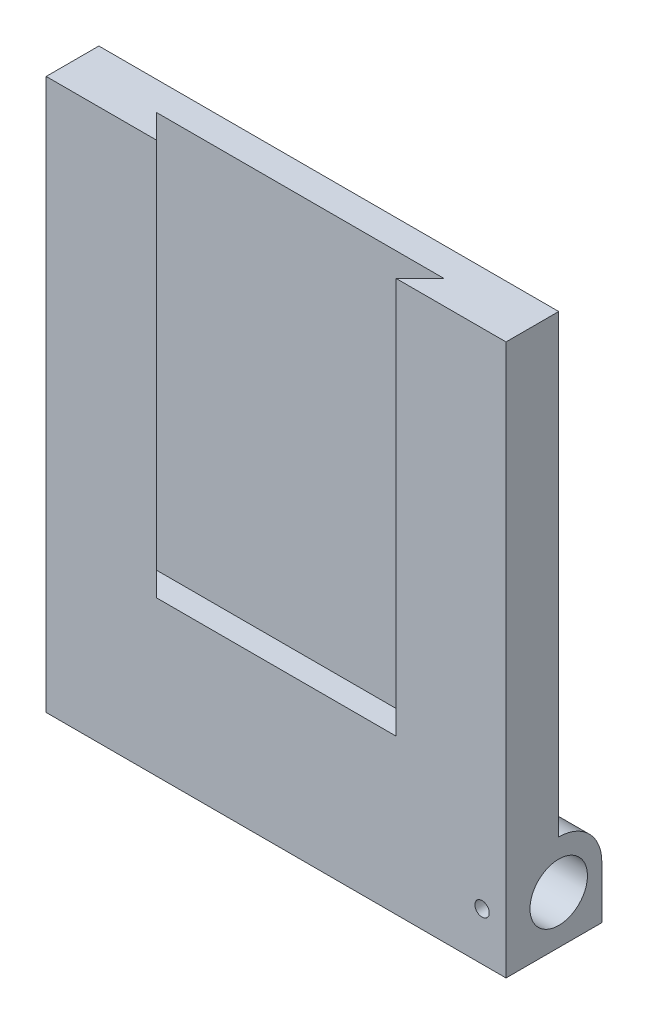
from build123d import *

# Parameters (mm, degrees)
BOSS_EXTRUDE1_DEPTH = 10
BOSS_EXTRUDE3_DEPTH = 10
CUT_EXTRUDE1_DEPTH  = 20
CUT_EXTRUDE2_DEPTH  = 20
SKETCH5_R           = 6
CUT_EXTRUDE3_DEPTH  = 18
SKETCH11_W          = 96
SKETCH11_H          = 11
BOSS_EXTRUDE2_DEPTH = 95
CUT_EXTRUDE10_DEPTH = 20
CUT_EXTRUDE11_DEPTH = 82.75
FILLET3_R           = 9
SKETCH18_R          = 1.5
CUT_EXTRUDE12_DEPTH = 10


with BuildPart() as part:
    # Sketch2 → Boss-Extrude1 (new body)
    with BuildSketch(Plane(origin=(0, 0, 0), x_dir=(1, 0, 0), z_dir=(0, 1, 0))):
        Polygon((-48, 0), (48, 0), (48, 20), (10, 20), (10, 11), (-10, 11), (-10, 20), (-48, 20), align=None)
    extrude(amount=BOSS_EXTRUDE1_DEPTH)

    # Sketch16 → Boss-Extrude3 (add)
    with BuildSketch(Plane.XZ):
        Polygon((-48, 0), (48, 0), (48, -20), (10, -20), (10, -10), (-10, -10), (-10, -20), (-48, -20), align=None)
    extrude(amount=BOSS_EXTRUDE3_DEPTH)

    # Sketch3 → Cut-Extrude1 (cut)
    with BuildSketch(Plane(origin=(-10, 0, 0), x_dir=(0, 0, -1), z_dir=(1, 0, 0))):
        Polygon((16.773502692, 0), (13.886751346, 5), (8.113248654, 5), (5.226497308, 0), (8.113248654, -5), (13.886751346, -5), align=None)
    extrude(amount=-CUT_EXTRUDE1_DEPTH, mode=Mode.SUBTRACT)

    # Sketch4 → Cut-Extrude2 (cut)
    with BuildSketch(Plane.ZY.offset(-10)):
        Polygon((-16.773502692, 0), (-13.886751346, -5), (-12, -5), (-12, -10), (-10, -10), (-10, -5), (-8.113248654, -5), (-5.226497308, 0), (-8.113248654, 5), (-13.886751346, 5), align=None)
    extrude(amount=-CUT_EXTRUDE2_DEPTH, mode=Mode.SUBTRACT)

    # Sketch5 → Cut-Extrude3 (cut)
    with BuildSketch(Plane.ZY.offset(-30)):
        with Locations((-11, 0)):
            Circle(SKETCH5_R)
    extrude(amount=-CUT_EXTRUDE3_DEPTH, mode=Mode.SUBTRACT)

    # Sketch11 → Boss-Extrude2 (add)
    with BuildSketch(Plane(origin=(0, 10, 0), x_dir=(1, 0, 0), z_dir=(0, 1, 0))):
        with Locations((0, 5.5)):
            Rectangle(SKETCH11_W, SKETCH11_H)
    extrude(amount=BOSS_EXTRUDE2_DEPTH)

    # Sketch14 → Cut-Extrude10 (cut)
    with BuildSketch(Plane(origin=(-10, 0, 0), x_dir=(0, 0, -1), z_dir=(1, 0, 0))):
        with BuildLine():
            Line((11, -9), (11, 18))
            Line((11, 18), (3.205771366, 4.5))
            ThreePointArc((3.205771366, 4.5), (3.205771366, -4.5), (11, -9))
        make_face()
    extrude(amount=CUT_EXTRUDE10_DEPTH, mode=Mode.SUBTRACT)

    # Sketch17 → Cut-Extrude11 (cut)
    with BuildSketch(Plane(origin=(0, 105, 0), x_dir=(1, 0, 0), z_dir=(0, 1, 0))):
        Polygon((25, 0), (-25, 0), (-30, 5), (30, 5), align=None)
    extrude(amount=-CUT_EXTRUDE11_DEPTH, mode=Mode.SUBTRACT)

    # Fillet3
    fillet3_edges = [part.edges().sort_by_distance(p)[0] for p in [
        (29, 10, -20),
        (-29, 10, -20),
    ]]
    fillet(fillet3_edges, radius=FILLET3_R - 0.0001)  # a hair under: the kernel refuses the full size

    # Sketch18 → Cut-Extrude12 (cut)
    with BuildSketch(Plane.XY):
        with Locations((43, 0)):
            Circle(SKETCH18_R)
    extrude(amount=-CUT_EXTRUDE12_DEPTH, mode=Mode.SUBTRACT)


solid = part.part
